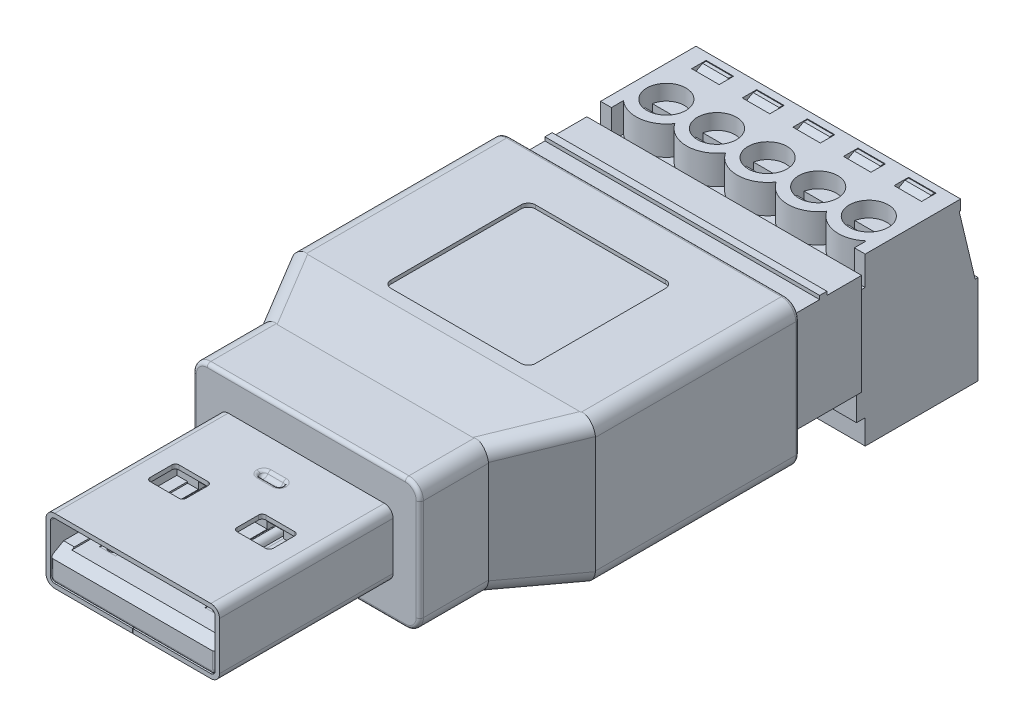
from build123d import *
from build123d.topology import SkipClean

# Parameters (mm, degrees)
BOSS_EXTRUDE1_START             = 5
BOSS_EXTRUDE1_DEPTH             = 10
CUT_EXTRUDE1_DEPTH              = 18.183494988
CUT_EXTRUDE1_DEPTH_BACK         = 18.183494988
BOSS_EXTRUDE2_DEPTH             = 9.5
BOSS_EXTRUDE3_DEPTH             = 9.15
SKETCH9_R                       = 1.35
SKETCH9_W                       = 1.9
SKETCH9_H                       = 1
CUT_EXTRUDE2_DEPTH              = 2
CUT_EXTRUDE3_DEPTH              = 2
BOSS_EXTRUDE4_REACH             = 29.744
SKETCH13_W                      = 0.05
SKETCH13_H                      = 1
CUT_EXTRUDE4_DEPTH              = 10
SKETCH15_W                      = 2.5
SKETCH15_H                      = 4
CUT_EXTRUDE5_DEPTH              = 2
DRAFT1_ANGLE                    = 5
DRAFT2_ANGLE                    = 30
SKETCH16_W                      = 8.575022673
SKETCH16_H                      = 3.670322135
CUT_EXTRUDE6_DEPTH              = 2
SKETCH17_W                      = 0.4
SKETCH17_H                      = 0.8
BOSS_EXTRUDE5_DEPTH             = 8.575022673
SKETCH18_W                      = 1.9
SKETCH18_H                      = 1
CUT_EXTRUDE7_DEPTH              = 1
BOSS_EXTRUDE6_REACH             = 29.744
CUT_EXTRUDE8_DEPTH              = 1
CUT_EXTRUDE8_DEPTH_BACK         = 0.5
SKETCH20_W                      = 0.05
SKETCH20_H                      = 1
SKETCH21_W                      = 0.7
SKETCH21_H                      = 0.6
CUT_EXTRUDE9_DEPTH              = 3
CUT_EXTRUDE10_DEPTH             = 0.25
FILLET1_R                       = 1
FILLET2_R                       = 0.25
EXTRUDE_THIN1_DEPTH             = 12
REVOLVE1_ANGLE                  = 180
FILLET3_R                       = 0.25
CUT_EXTRUDE12_DEPTH             = 29.410825525
CUT_EXTRUDE_THIN1_DEPTH         = 0.3
SKETCH31_R                      = 1.25
BOSS_EXTRUDE7_DEPTH             = 1
SKETCH32_W                      = 2.7
SKETCH32_H                      = 0.5
CUT_EXTRUDE13_DEPTH             = 0.5
LPATTERN1_COUNT                 = 5
LPATTERN1_PITCH                 = 3.5
BOSS_EXTRUDE8_REACH             = 29.744
BOSS_EXTRUDE8_DIRECTION_2_REACH = 29.744
FILLET4_R                       = 0.3
CHAMFER1_SIZE                   = 0.53
CHAMFER1_SIZE2                  = 0.917986928
SKETCH35_W                      = 1.125
SKETCH35_H                      = 6.85
SKETCH35_H_2                    = 5.85
CUT_EXTRUDE14_DEPTH             = 0.15
SKETCH36_W                      = 1.125
SKETCH36_H                      = 3.25
CUT_EXTRUDE15_DEPTH             = 0.525
BOSS_EXTRUDE9_DEPTH             = 0.35
BOSS_EXTRUDE9_2_DEPTH           = 0.35
BOSS_EXTRUDE9_3_DEPTH           = 0.35
BOSS_EXTRUDE9_4_DEPTH           = 0.35
SKETCH38_OUTSIDE_W              = 31.578
SKETCH38_OUTSIDE_H              = 25.028
SKETCH38_OUTSIDE_R              = 0.35
CUT_EXTRUDE16_DEPTH             = 40.412942063
CUT_EXTRUDE17_DEPTH             = 28.743693104
CUT_EXTRUDE17_DEPTH_BACK        = 28.743693104
CUT_EXTRUDE18_DEPTH             = 28.743693104
CUT_EXTRUDE18_DEPTH_BACK        = 28.743693104
SKETCH41_W                      = 9.9125
SKETCH41_H                      = 8.75
CUT_EXTRUDE19_DEPTH             = 0.1
FILLET5_R                       = 0.2
CUT_EXTRUDE20_DEPTH             = 0.25


with BuildPart() as part:
    # Sketch4 → Boss-Extrude1 (new body)
    with BuildSketch(Plane(origin=(0, 0, 0), x_dir=(1, 0, 0), z_dir=(0, 1, 0)).offset(BOSS_EXTRUDE1_START)):
        Polygon((-10.5, 10.95), (0, 10.95), (0, -12.65), (-7.85, -12.65), (-7.85, -7.9), (-10.5, -3.15), align=None)
    extrude(amount=-BOSS_EXTRUDE1_DEPTH)

    # Sketch5 → Cut-Extrude1 (cut, two sides: drawn at the far end of the back side and taken through both)
    with BuildSketch(Plane(origin=(0, 0, 0), x_dir=(0, 0, -1), z_dir=(1, 0, 0)).offset(-CUT_EXTRUDE1_DEPTH_BACK)):
        Polygon((41.177338913, -9.666035675), (-3.15, -5), (-7.9, -4.5), (-12.65, -4.5), (-12.65, 4.5), (-7.9, 4.5), (-3.15, 5), (41.177338913, 9.666035675), (-47.96714749, 9.666035675), (-47.96714749, -9.666035675), align=None)
    extrude(amount=CUT_EXTRUDE1_DEPTH + CUT_EXTRUDE1_DEPTH_BACK, mode=Mode.SUBTRACT)

    # Sketch23 → Cut-Extrude10 (cut)
    with BuildSketch(Plane(origin=(0, 5, 0), x_dir=(1, 0, 0), z_dir=(0, 1, 0))):
        with BuildLine():
            Line((-4.5, 7.7), (4.5, 7.7))
            ThreePointArc((4.5, 7.7), (4.853553391, 7.553553391), (5, 7.2))
            Line((5, 7.2), (5, -1.8))
            ThreePointArc((5, -1.8), (4.853553391, -2.153553391), (4.5, -2.3))
            Line((4.5, -2.3), (-4.5, -2.3))
            ThreePointArc((-4.5, -2.3), (-4.853553391, -2.153553391), (-5, -1.8))
            Line((-5, -1.8), (-5, 7.2))
            ThreePointArc((-5, 7.2), (-4.853553391, 7.553553391), (-4.5, 7.7))
        make_face()
    extrude(amount=-CUT_EXTRUDE10_DEPTH, mode=Mode.SUBTRACT)

    # Fillet1
    # the kernel refuses this fillet: 1 mm, written as the material it takes off along each edge
    with BuildSketch(Plane(origin=(-7.85, -4.5, 15.15), x_dir=(1, 0, 0), z_dir=(0, 0, -1))) as fillet1_piece_1_section:
        with BuildLine():
            CenterArc((FILLET1_R, -FILLET1_R), FILLET1_R, 90, 90)
            Line((0, -FILLET1_R), (0, 0))
            Line((0, 0), (FILLET1_R, 0))
        make_face()
    fillet1_piece_1 = extrude(amount=9.75, mode=Mode.PRIVATE)
    fillet1_piece_1 = split(fillet1_piece_1, bisect_by=Plane(origin=(-5.900487361, -4.351700384, 11.394409448), z_dir=(-0.8732886642419329, 0, 0.487203149524447)), keep=Keep.TOP, mode=Mode.PRIVATE)
    fillet1_piece_1 = split(fillet1_piece_1, bisect_by=Plane(origin=(-7.58529816, -4.036715763, 12.30120025), z_dir=(0, -0.9945054529214061, 0.10468478451804247)), keep=Keep.TOP, mode=Mode.PRIVATE)
    add(fillet1_piece_1, mode=Mode.SUBTRACT)
    with BuildSketch(Plane(origin=(-7.85, -4.5, 15.15), x_dir=(1, 0, 0), z_dir=(0, 0, -1))) as fillet1_piece_2_section:
        with BuildLine():
            CenterArc((FILLET1_R, -FILLET1_R), FILLET1_R, 90, 90)
            Line((0, -FILLET1_R), (0, 0))
            Line((0, 0), (FILLET1_R, 0))
        make_face()
    fillet1_piece_2 = extrude(amount=9.75, mode=Mode.PRIVATE)
    fillet1_piece_2 = split(fillet1_piece_2, bisect_by=Plane(origin=(-6.896060868, -4.042549312, 9.609890897), z_dir=(-0.8732886642419329, 0, 0.487203149524447)), keep=Keep.TOP, mode=Mode.PRIVATE)
    fillet1_piece_2 = split(fillet1_piece_2, bisect_by=Plane(origin=(-7.768276495, -4.266310608, 10.120049226), z_dir=(0, 0.9945054529214061, -0.10468478451804247)), keep=Keep.TOP, mode=Mode.PRIVATE)
    add(fillet1_piece_2, mode=Mode.SUBTRACT)
    with BuildSketch(Plane(origin=(-7.85, -4.5, 15.15), x_dir=(1, 0, 0), z_dir=(0, 0, -1))) as fillet1_piece_3_section:
        with BuildLine():
            CenterArc((FILLET1_R, -FILLET1_R), FILLET1_R, 90, 90)
            Line((0, -FILLET1_R), (0, 0))
            Line((0, 0), (FILLET1_R, 0))
        make_face()
    fillet1_piece_3 = extrude(amount=9.75, mode=Mode.PRIVATE)
    fillet1_piece_3 = split(fillet1_piece_3, bisect_by=Plane(origin=(-7.455417166, -4.491750675, 8.607271118), z_dir=(0.8732886642419329, 0, -0.487203149524447)), keep=Keep.TOP, mode=Mode.PRIVATE)
    fillet1_piece_3 = split(fillet1_piece_3, bisect_by=Plane(origin=(-7.239168841, -4.438836068, 8.481057357), z_dir=(0, -0.9945054529214061, 0.10468478451804247)), keep=Keep.TOP, mode=Mode.PRIVATE)
    add(fillet1_piece_3, mode=Mode.SUBTRACT)
    with BuildSketch(Plane(origin=(-7.85, 4.5, 5.4), x_dir=(1, 0, 0), z_dir=(0, 0, 1))) as fillet1_piece_4_section:
        with BuildLine():
            CenterArc((FILLET1_R, -FILLET1_R), FILLET1_R, 90, 90)
            Line((0, -FILLET1_R), (0, 0))
            Line((0, 0), (FILLET1_R, 0))
        make_face()
    fillet1_piece_4 = extrude(amount=9.75, mode=Mode.PRIVATE)
    fillet1_piece_4 = split(fillet1_piece_4, bisect_by=Plane(origin=(-6.896060868, 4.042549312, 9.609890897), z_dir=(-0.8732886642419329, 0, 0.487203149524447)), keep=Keep.TOP, mode=Mode.PRIVATE)
    fillet1_piece_4 = split(fillet1_piece_4, bisect_by=Plane(origin=(-7.768276495, 4.266310608, 10.120049226), z_dir=(0, -0.9945054529214061, -0.10468478451804242)), keep=Keep.TOP, mode=Mode.PRIVATE)
    add(fillet1_piece_4, mode=Mode.SUBTRACT)
    with BuildSketch(Plane(origin=(-7.85, 4.5, 5.4), x_dir=(1, 0, 0), z_dir=(0, 0, 1))) as fillet1_piece_5_section:
        with BuildLine():
            CenterArc((FILLET1_R, -FILLET1_R), FILLET1_R, 90, 90)
            Line((0, -FILLET1_R), (0, 0))
            Line((0, 0), (FILLET1_R, 0))
        make_face()
    fillet1_piece_5 = extrude(amount=9.75, mode=Mode.PRIVATE)
    fillet1_piece_5 = split(fillet1_piece_5, bisect_by=Plane(origin=(-7.455417166, 4.491750675, 8.607271118), z_dir=(0.8732886642419329, 0, -0.487203149524447)), keep=Keep.TOP, mode=Mode.PRIVATE)
    fillet1_piece_5 = split(fillet1_piece_5, bisect_by=Plane(origin=(-7.239168841, 4.438836068, 8.481057357), z_dir=(0, 0.9945054529214061, 0.10468478451804242)), keep=Keep.TOP, mode=Mode.PRIVATE)
    add(fillet1_piece_5, mode=Mode.SUBTRACT)
    with BuildSketch(Plane(origin=(-7.85, 4.5, 5.4), x_dir=(1, 0, 0), z_dir=(0, 0, 1))) as fillet1_piece_6_section:
        with BuildLine():
            CenterArc((FILLET1_R, -FILLET1_R), FILLET1_R, 90, 90)
            Line((0, -FILLET1_R), (0, 0))
            Line((0, 0), (FILLET1_R, 0))
        make_face()
    fillet1_piece_6 = extrude(amount=9.75, mode=Mode.PRIVATE)
    fillet1_piece_6 = split(fillet1_piece_6, bisect_by=Plane(origin=(-5.900487361, 4.351700384, 11.394409448), z_dir=(-0.8732886642419329, 0, 0.487203149524447)), keep=Keep.TOP, mode=Mode.PRIVATE)
    fillet1_piece_6 = split(fillet1_piece_6, bisect_by=Plane(origin=(-7.58529816, 4.036715763, 12.30120025), z_dir=(0, 0.9945054529214061, 0.10468478451804242)), keep=Keep.TOP, mode=Mode.PRIVATE)
    add(fillet1_piece_6, mode=Mode.SUBTRACT)
    with BuildSketch(Plane(origin=(-11.652533107, 5.217459077, 1.084138771), x_dir=(-0.04459817325900825, -0.9958014761265791, -0.07994012187935078), z_dir=(0.4851576154699628, -0.09153917273018133, 0.8696221409367253))) as fillet1_piece_7_section:
        with BuildLine():
            CenterArc((FILLET1_R * 0.950233960928, FILLET1_R), FILLET1_R, 182.923511118, 87.076488882)
            Line((-FILLET1_R * 0.0484645515405, FILLET1_R * 0.948997243276), (0, 0))
            Line((0, 0), (FILLET1_R * 0.950233960928, 0))
        make_face()
    fillet1_piece_7 = extrude(amount=10.213312241, mode=Mode.PRIVATE)
    fillet1_piece_7 = split(fillet1_piece_7, bisect_by=Plane(origin=(-7.85, 4.282028082, 5.783422109), z_dir=(-1, 0, 0)), keep=Keep.TOP, mode=Mode.PRIVATE)
    fillet1_piece_7 = split(fillet1_piece_7, bisect_by=Plane(origin=(-8.947322125, 4.5, 5.783422109), z_dir=(0, -1, 0)), keep=Keep.TOP, mode=Mode.PRIVATE)
    add(fillet1_piece_7, mode=Mode.SUBTRACT)
    with BuildSketch(Plane(origin=(-11.652533107, 5.217459077, 1.084138771), x_dir=(-0.04459817325900825, -0.9958014761265791, -0.07994012187935078), z_dir=(0.4851576154699628, -0.09153917273018133, 0.8696221409367253))) as fillet1_piece_8_section:
        with BuildLine():
            CenterArc((FILLET1_R * 0.950233960928, FILLET1_R), FILLET1_R, 182.923511118, 87.076488882)
            Line((-FILLET1_R * 0.0484645515405, FILLET1_R * 0.948997243276), (0, 0))
            Line((0, 0), (FILLET1_R * 0.950233960928, 0))
        make_face()
    fillet1_piece_8 = extrude(amount=10.213312241, mode=Mode.PRIVATE)
    fillet1_piece_8 = split(fillet1_piece_8, bisect_by=Plane(origin=(-7.85, 4.808921176, 3.642336473), z_dir=(-1, 0, 0)), keep=Keep.TOP, mode=Mode.PRIVATE)
    fillet1_piece_8 = split(fillet1_piece_8, bisect_by=Plane(origin=(-9.936894262, 4.5, 3.642336473), z_dir=(0, 1, 0)), keep=Keep.TOP, mode=Mode.PRIVATE)
    add(fillet1_piece_8, mode=Mode.SUBTRACT)
    with BuildSketch(Plane(origin=(-11.652533107, 5.217459077, 1.084138771), x_dir=(-0.04459817325900825, -0.9958014761265791, -0.07994012187935078), z_dir=(0.4851576154699628, -0.09153917273018133, 0.8696221409367253))) as fillet1_piece_9_section:
        with BuildLine():
            CenterArc((FILLET1_R * 0.950233960928, FILLET1_R), FILLET1_R, 182.923511118, 87.076488882)
            Line((-FILLET1_R * 0.0484645515405, FILLET1_R * 0.948997243276), (0, 0))
            Line((0, 0), (FILLET1_R * 0.950233960928, 0))
        make_face()
    fillet1_piece_9 = extrude(amount=10.213312241, mode=Mode.PRIVATE)
    fillet1_piece_9 = split(fillet1_piece_9, bisect_by=Plane(origin=(-7.85, 4.557677752, 7.268472572), z_dir=(1, 0, 0)), keep=Keep.TOP, mode=Mode.PRIVATE)
    fillet1_piece_9 = split(fillet1_piece_9, bisect_by=Plane(origin=(-7.544307912, 4.5, 7.268472572), z_dir=(0, 1, 0)), keep=Keep.TOP, mode=Mode.PRIVATE)
    add(fillet1_piece_9, mode=Mode.SUBTRACT)
    with BuildSketch(Plane(origin=(-6.697466893, -4.282540923, 9.965861229), x_dir=(-0.04459817325900605, 0.9958014761265791, -0.07994012187935205), z_dir=(-0.4851576154699628, -0.09153917273018138, -0.8696221409367253))) as fillet1_piece_10_section:
        with BuildLine():
            CenterArc((FILLET1_R * 0.950233960928, FILLET1_R), FILLET1_R, 182.923511118, 87.076488882)
            Line((-FILLET1_R * 0.0484645515405, FILLET1_R * 0.948997243276), (0, 0))
            Line((0, 0), (FILLET1_R * 0.950233960928, 0))
        make_face()
    fillet1_piece_10 = extrude(amount=10.213312241, mode=Mode.PRIVATE)
    fillet1_piece_10 = split(fillet1_piece_10, bisect_by=Plane(origin=(-7.85, -4.557677752, 7.268472572), z_dir=(1, 0, 0)), keep=Keep.TOP, mode=Mode.PRIVATE)
    fillet1_piece_10 = split(fillet1_piece_10, bisect_by=Plane(origin=(-7.544307912, -4.5, 7.268472572), z_dir=(0, -1, 0)), keep=Keep.TOP, mode=Mode.PRIVATE)
    add(fillet1_piece_10, mode=Mode.SUBTRACT)
    with BuildSketch(Plane(origin=(-6.697466893, -4.282540923, 9.965861229), x_dir=(-0.04459817325900605, 0.9958014761265791, -0.07994012187935205), z_dir=(-0.4851576154699628, -0.09153917273018138, -0.8696221409367253))) as fillet1_piece_11_section:
        with BuildLine():
            CenterArc((FILLET1_R * 0.950233960928, FILLET1_R), FILLET1_R, 182.923511118, 87.076488882)
            Line((-FILLET1_R * 0.0484645515405, FILLET1_R * 0.948997243276), (0, 0))
            Line((0, 0), (FILLET1_R * 0.950233960928, 0))
        make_face()
    fillet1_piece_11 = extrude(amount=10.213312241, mode=Mode.PRIVATE)
    fillet1_piece_11 = split(fillet1_piece_11, bisect_by=Plane(origin=(-7.85, -4.282028082, 5.783422109), z_dir=(-1, 0, 0)), keep=Keep.TOP, mode=Mode.PRIVATE)
    fillet1_piece_11 = split(fillet1_piece_11, bisect_by=Plane(origin=(-8.947322125, -4.5, 5.783422109), z_dir=(0, 1, 0)), keep=Keep.TOP, mode=Mode.PRIVATE)
    add(fillet1_piece_11, mode=Mode.SUBTRACT)
    with BuildSketch(Plane(origin=(-6.697466893, -4.282540923, 9.965861229), x_dir=(-0.04459817325900605, 0.9958014761265791, -0.07994012187935205), z_dir=(-0.4851576154699628, -0.09153917273018138, -0.8696221409367253))) as fillet1_piece_12_section:
        with BuildLine():
            CenterArc((FILLET1_R * 0.950233960928, FILLET1_R), FILLET1_R, 182.923511118, 87.076488882)
            Line((-FILLET1_R * 0.0484645515405, FILLET1_R * 0.948997243276), (0, 0))
            Line((0, 0), (FILLET1_R * 0.950233960928, 0))
        make_face()
    fillet1_piece_12 = extrude(amount=10.213312241, mode=Mode.PRIVATE)
    fillet1_piece_12 = split(fillet1_piece_12, bisect_by=Plane(origin=(-7.85, -4.808921176, 3.642336473), z_dir=(-1, 0, 0)), keep=Keep.TOP, mode=Mode.PRIVATE)
    fillet1_piece_12 = split(fillet1_piece_12, bisect_by=Plane(origin=(-9.936894262, -4.5, 3.642336473), z_dir=(0, -1, 0)), keep=Keep.TOP, mode=Mode.PRIVATE)
    add(fillet1_piece_12, mode=Mode.SUBTRACT)
    with BuildSketch(Plane(origin=(-10.5, -5, 5.65), x_dir=(0, 1, 0), z_dir=(0, 0, -1))) as fillet1_piece_13:
        with BuildLine():
            CenterArc((FILLET1_R, FILLET1_R), FILLET1_R, 180, 90)
            Line((0, FILLET1_R), (0, 0))
            Line((0, 0), (FILLET1_R, 0))
        make_face()
    extrude(amount=19.1, mode=Mode.SUBTRACT)
    with BuildSketch(Plane(origin=(-10.5, 5, 5.65), x_dir=(0, -1, 0), z_dir=(0, 0, -1))) as fillet1_piece_14:
        with BuildLine():
            CenterArc((FILLET1_R, -FILLET1_R), FILLET1_R, 90, 90)
            Line((0, -FILLET1_R), (0, 0))
            Line((0, 0), (FILLET1_R, 0))
        make_face()
    extrude(amount=19.1, mode=Mode.SUBTRACT)
    with BuildSketch(Plane(origin=(-6.697466893, -4.282540923, 9.965861229), x_dir=(-0.04459817325900605, 0.9958014761265791, -0.07994012187935205), z_dir=(-0.4851576154699628, -0.09153917273018138, -0.8696221409367253))) as fillet1_piece_15a_section:
        with BuildLine():
            CenterArc((FILLET1_R * 0.950233960928, FILLET1_R), FILLET1_R, 182.923511118, 87.076488882)
            Line((-FILLET1_R * 0.0484645515405, FILLET1_R * 0.948997243276), (0, 0))
            Line((0, 0), (FILLET1_R * 0.950233960928, 0))
        make_face()
    fillet1_piece_15a = extrude(amount=10.213312241, mode=Mode.PRIVATE)
    fillet1_piece_15a = split(fillet1_piece_15a, bisect_by=Plane(origin=(-7.85, -4.198194063, 8.73799321), z_dir=(1, 0, 0)), keep=Keep.TOP, mode=Mode.PRIVATE)
    fillet1_piece_15a = split(fillet1_piece_15a, bisect_by=Plane(origin=(-7.138897424, -4.5, 8.73799321), z_dir=(0, 1, 0)), keep=Keep.TOP, mode=Mode.PRIVATE)
    with BuildSketch(Plane(origin=(-7.85, -4.5, 15.15), x_dir=(1, 0, 0), z_dir=(0, 0, -1))) as fillet1_piece_15b_section:
        with BuildLine():
            CenterArc((FILLET1_R, -FILLET1_R), FILLET1_R, 90, 90)
            Line((0, -FILLET1_R), (0, 0))
            Line((0, 0), (FILLET1_R, 0))
        make_face()
    fillet1_piece_15b = extrude(amount=9.75, mode=Mode.PRIVATE)
    fillet1_piece_15b = split(fillet1_piece_15b, bisect_by=Plane(origin=(-8.271489961, -4.278118065, 7.144499127), z_dir=(0.8732886642419329, 0, -0.487203149524447)), keep=Keep.TOP, mode=Mode.PRIVATE)
    fillet1_piece_15b = split(fillet1_piece_15b, bisect_by=Plane(origin=(-7.616902316, -4.614243188, 6.814689717), z_dir=(0, 0.9945054529214061, -0.10468478451804247)), keep=Keep.TOP, mode=Mode.PRIVATE)
    fillet1_piece_15 = fillet1_piece_15a & fillet1_piece_15b
    add(fillet1_piece_15, mode=Mode.SUBTRACT)
    with BuildSketch(Plane(origin=(-11.652533107, 5.217459077, 1.084138771), x_dir=(-0.04459817325900825, -0.9958014761265791, -0.07994012187935078), z_dir=(0.4851576154699628, -0.09153917273018133, 0.8696221409367253))) as fillet1_piece_16a_section:
        with BuildLine():
            CenterArc((FILLET1_R * 0.950233960928, FILLET1_R), FILLET1_R, 182.923511118, 87.076488882)
            Line((-FILLET1_R * 0.0484645515405, FILLET1_R * 0.948997243276), (0, 0))
            Line((0, 0), (FILLET1_R * 0.950233960928, 0))
        make_face()
    fillet1_piece_16a = extrude(amount=10.213312241, mode=Mode.PRIVATE)
    fillet1_piece_16a = split(fillet1_piece_16a, bisect_by=Plane(origin=(-7.85, 4.198194063, 8.73799321), z_dir=(1, 0, 0)), keep=Keep.TOP, mode=Mode.PRIVATE)
    fillet1_piece_16a = split(fillet1_piece_16a, bisect_by=Plane(origin=(-7.138897424, 4.5, 8.73799321), z_dir=(0, -1, 0)), keep=Keep.TOP, mode=Mode.PRIVATE)
    with BuildSketch(Plane(origin=(-7.85, 4.5, 5.4), x_dir=(1, 0, 0), z_dir=(0, 0, 1))) as fillet1_piece_16b_section:
        with BuildLine():
            CenterArc((FILLET1_R, -FILLET1_R), FILLET1_R, 90, 90)
            Line((0, -FILLET1_R), (0, 0))
            Line((0, 0), (FILLET1_R, 0))
        make_face()
    fillet1_piece_16b = extrude(amount=9.75, mode=Mode.PRIVATE)
    fillet1_piece_16b = split(fillet1_piece_16b, bisect_by=Plane(origin=(-8.271489961, 4.278118065, 7.144499127), z_dir=(0.8732886642419329, 0, -0.487203149524447)), keep=Keep.TOP, mode=Mode.PRIVATE)
    fillet1_piece_16b = split(fillet1_piece_16b, bisect_by=Plane(origin=(-7.616902316, 4.614243188, 6.814689717), z_dir=(0, -0.9945054529214061, -0.10468478451804242)), keep=Keep.TOP, mode=Mode.PRIVATE)
    fillet1_piece_16 = fillet1_piece_16a & fillet1_piece_16b
    add(fillet1_piece_16, mode=Mode.SUBTRACT)

    # Fillet2
    fillet2_edges = [part.edges().sort_by_distance(p)[0] for p in [
        (-4.75, -5, -10.95),
        (-3.425, 4.5, 12.65),
        (-3.425, -4.5, 12.65),
        (-4.75, 5, -10.95),
        (-7.85, 0, 12.65),
        (-7.557106781, 4.207106781, 12.65),
        (-7.557106781, -4.207106781, 12.65),
        (-10.5, 0, -10.95),
        (-10.207106781, 4.707106781, -10.95),
        (-10.207106781, -4.707106781, -10.95),
    ]]
    fillet(fillet2_edges, radius=FILLET2_R)

    # Mirror1 3: part across plane


with BuildPart() as body_2:
    # Sketch7 → Boss-Extrude2 (new body)
    with BuildSketch(Plane(origin=(0, 0, 0), x_dir=(0, 0, -1), z_dir=(1, 0, 0))):
        Polygon((10.95, 3.5), (13.35, 3.5), (13.35, 3.75), (13.85, 3.75), (13.85, 3.5), (16.25, 3.5), (16.25, -3.5), (10.95, -3.5), align=None)
    extrude(amount=-BOSS_EXTRUDE2_DEPTH)

    # Mirror1 2: body 2 across plane


with BuildPart() as body_3:
    # Sketch8 → Boss-Extrude3 (new body)
    with BuildSketch(Plane(origin=(0, 0, 0), x_dir=(0, 0, -1), z_dir=(1, 0, 0))):
        Polygon((16.85, -5.5), (16.25, -5.5), (16.25, 2.3), (16.85, 2.3), (16.85, 4.3), (23.45, 4.3), (23.45, 3.6), (23.35, 3.6), (24.45, -1), (24.65, -1), (24.65, -7.2), (16.85, -7.2), align=None)
    extrude(amount=-BOSS_EXTRUDE3_DEPTH)

    # Sketch9 → Cut-Extrude2 (cut)
    with BuildSketch(Plane(origin=(0, 4.3, 0), x_dir=(1, 0, 0), z_dir=(0, 1, 0))):
        with Locations((0, 19.25)):
            Circle(SKETCH9_R)
        with Locations(Location((-3.5, 19.25, 0), (0, 0, 270))):
            Circle(SKETCH9_R)
        with Locations(Location((-7, 19.25, 0), (0, 0, 270))):
            Circle(SKETCH9_R)
        with Locations((-7, 22.45)):
            Rectangle(SKETCH9_W, SKETCH9_H)
        with Locations((-3.5, 22.45)):
            Rectangle(SKETCH9_W, SKETCH9_H)
        with Locations((0, 22.45)):
            Rectangle(SKETCH9_W, SKETCH9_H)
    extrude(amount=-CUT_EXTRUDE2_DEPTH, mode=Mode.SUBTRACT)

    # Sketch10 → Cut-Extrude3 (cut)
    with BuildSketch(Plane(origin=(0, 4.3, 0), x_dir=(1, 0, 0), z_dir=(0, 1, 0))):
        with BuildLine():
            Line((-8.4, 17.684752416), (-8.4, 16.85))
            Line((-8.4, 16.85), (0, 16.85))
            Line((0, 16.85), (0, 17.15))
            ThreePointArc((0, 17.15), (-0.993046016, 17.399632574), (-1.75, 18.089181323))
            ThreePointArc((-1.75, 18.089181323), (-3.5, 17.15), (-5.25, 18.089181323))
            ThreePointArc((-5.25, 18.089181323), (-6.732575833, 17.167097142), (-8.4, 17.684752416))
        make_face()
    extrude(amount=-CUT_EXTRUDE3_DEPTH, mode=Mode.SUBTRACT)

    # Boss-Extrude4: up to this face of the body (flat: up to its plane)
    boss_extrude4_end = Plane(body_3.part.faces().sort_by_distance((-7.95, 3.3, -22.45))[0])
    # Sketch12 → Boss-Extrude4 (add, up to the picked face)
    with BuildSketch(Plane(origin=(0, 0, 0), x_dir=(0, 0, -1), z_dir=(1, 0, 0)), mode=Mode.PRIVATE) as boss_extrude4_sk1:
        Polygon((22.9, 4.3), (22.9, 3.3), (22.95, 3.3), (22.95, 2.3), (21.95, 2.3), (21.95, 3.6), (22.2, 3.6), (22.2, 4.040192379), (22.65, 4.3), align=None)
    boss_extrude4_tool1 = split(extrude(boss_extrude4_sk1.sketch, amount=-BOSS_EXTRUDE4_REACH, mode=Mode.PRIVATE), bisect_by=boss_extrude4_end, keep=Keep.BOTH, mode=Mode.PRIVATE)
    add(boss_extrude4_tool1.solids().sort_by(Axis((0, 3.188063, -22.4778), (-1, 0, 0)))[0])

    # Sketch13 → Cut-Extrude4 (cut)
    with BuildSketch(Plane(origin=(0, 3.6, 0), x_dir=(1, 0, 0), z_dir=(0, 1, 0))):
        with Locations((-7.925, 22.45)):
            Rectangle(SKETCH13_W, SKETCH13_H)
        with Locations((-6.075, 22.45)):
            Rectangle(SKETCH13_W, SKETCH13_H)
        with Locations((-4.425, 22.45)):
            Rectangle(SKETCH13_W, SKETCH13_H)
        with Locations((-2.575, 22.45)):
            Rectangle(SKETCH13_W, SKETCH13_H)
        with Locations((-0.925, 22.45)):
            Rectangle(SKETCH13_W, SKETCH13_H)
    extrude(amount=CUT_EXTRUDE4_DEPTH, mode=Mode.SUBTRACT)

    # Sketch15 → Cut-Extrude5 (cut)
    with BuildSketch(Plane(origin=(0, 0, -24.65), x_dir=(-1, 0, 0), z_dir=(0, 0, -1))):
        with Locations((7, -3.85)):
            Rectangle(SKETCH15_W, SKETCH15_H)
        with Locations((3.5, -3.85)):
            Rectangle(SKETCH15_W, SKETCH15_H)
        with Locations((0, -3.85)):
            Rectangle(SKETCH15_W, SKETCH15_H)
    extrude(amount=-CUT_EXTRUDE5_DEPTH, mode=Mode.SUBTRACT)

    # Draft1
    draft1_faces = [body_3.faces().sort_by_distance(p)[0] for p in [
        (-0.625, -5.85, -23.65),
        (-3.5, -5.85, -23.65),
        (-2.25, -3.85, -23.65),
        (-1.25, -3.85, -23.65),
        (-4.75, -3.85, -23.65),
        (-7, -5.85, -23.65),
        (-8.25, -3.85, -23.65),
        (-5.75, -3.85, -23.65),
    ]]
    draft(draft1_faces, Plane(origin=(-9.15, -1, -24.65), x_dir=(0, -1, 0), z_dir=(0, 0, -1)), DRAFT1_ANGLE)

    # Draft2
    draft2_faces = [body_3.faces().sort_by_distance(p)[0] for p in [
        (-0.582353043, -1.85, -23.67508611),
        (-3.5, -1.85, -23.67508611),
        (-7, -1.85, -23.67508611),
    ]]
    draft(draft2_faces, Plane(origin=(-9.15, -1, -24.65), x_dir=(0, -1, 0), z_dir=(0, 0, -1)), DRAFT2_ANGLE)

    # Sketch16 → Cut-Extrude6 (cut)
    with BuildSketch(Plane(origin=(0, 0, -22.65), x_dir=(-1, 0, 0), z_dir=(0, 0, -1))):
        with Locations((4.287511337, -4.339861606)):
            Rectangle(SKETCH16_W, SKETCH16_H)
    extrude(amount=-CUT_EXTRUDE6_DEPTH, mode=Mode.SUBTRACT)

    # Sketch18 → Cut-Extrude7 (cut)
    with BuildSketch(Plane.XZ.offset(7.2)):
        with Locations((-7, -23.55)):
            Rectangle(SKETCH18_W, SKETCH18_H)
        with Locations((-3.5, -23.55)):
            Rectangle(SKETCH18_W, SKETCH18_H)
        with Locations((0, -23.55)):
            Rectangle(SKETCH18_W, SKETCH18_H)
    extrude(amount=-CUT_EXTRUDE7_DEPTH, mode=Mode.SUBTRACT)

    # Boss-Extrude6: up to this face of the body (flat: up to its plane)
    boss_extrude6_end = Plane(body_3.part.faces().sort_by_distance((-7.95, -6.7, -23.55))[0])
    # Sketch19 → Boss-Extrude6 (add, up to the picked face)
    with BuildSketch(Plane(origin=(0, 0, 0), x_dir=(0, 0, -1), z_dir=(1, 0, 0)), mode=Mode.PRIVATE) as boss_extrude6_sk1:
        Polygon((23.05, -6.7), (23.333493649, -6.7), (23.766506351, -6.95), (24.05, -6.95), (24.05, -6.2), (23.05, -6.2), align=None)
    boss_extrude6_tool1 = split(extrude(boss_extrude6_sk1.sketch, amount=-BOSS_EXTRUDE6_REACH, mode=Mode.PRIVATE), bisect_by=boss_extrude6_end, keep=Keep.BOTH, mode=Mode.PRIVATE)
    add(boss_extrude6_tool1.solids().sort_by(Axis((0, -6.521392, -23.596875), (-1, 0, 0)))[0])

    # Sketch20 → Cut-Extrude8 (cut, two sides: drawn at the far end of the back side and taken through both)
    with BuildSketch(Plane.XZ.offset(6.7).offset(-CUT_EXTRUDE8_DEPTH_BACK)):
        with Locations((-7.925, -23.55)):
            Rectangle(SKETCH20_W, SKETCH20_H)
        with Locations((-6.075, -23.55)):
            Rectangle(SKETCH20_W, SKETCH20_H)
        with Locations((-4.425, -23.55)):
            Rectangle(SKETCH20_W, SKETCH20_H)
        with Locations((-2.575, -23.55)):
            Rectangle(SKETCH20_W, SKETCH20_H)
        with Locations((-0.925, -23.55)):
            Rectangle(SKETCH20_W, SKETCH20_H)
    extrude(amount=CUT_EXTRUDE8_DEPTH + CUT_EXTRUDE8_DEPTH_BACK, mode=Mode.SUBTRACT)

    # Sketch21 → Cut-Extrude9 (cut)
    with BuildSketch(Plane.XZ.offset(5.5)):
        with Locations((-1.75, -16.55)):
            Rectangle(SKETCH21_W, SKETCH21_H)
        with Locations((-5.25, -16.55)):
            Rectangle(SKETCH21_W, SKETCH21_H)
    extrude(amount=-CUT_EXTRUDE9_DEPTH, mode=Mode.SUBTRACT)

    # Mirror1: body 3 across plane


with BuildPart() as body_4:
    # Sketch17 → Boss-Extrude5 (new body)
    with BuildSketch(Plane(origin=(-8.575022673, 0, 0), x_dir=(0, 0, -1), z_dir=(1, 0, 0))):
        with Locations((22.45, -2.904700538)):
            Rectangle(SKETCH17_W, SKETCH17_H)
    extrude(amount=BOSS_EXTRUDE5_DEPTH)

    # Mirror1 4: body 4 across plane


with BuildPart() as body_5:
    # Sketch24 → Extrude-Thin1 (new body)
    with BuildSketch(Plane.XY.offset(12.65)):
        with BuildLine():
            Line((6, -1.65), (6, 1.65))
            ThreePointArc((6, 1.65), (5.824264069, 2.074264069), (5.4, 2.25))
            Line((5.4, 2.25), (-5.4, 2.25))
            ThreePointArc((-5.4, 2.25), (-5.824264069, 2.074264069), (-6, 1.65))
            Line((-6, 1.65), (-6, -1.65))
            ThreePointArc((-6, -1.65), (-5.824264069, -2.074264069), (-5.4, -2.25))
            Line((-5.4, -2.25), (5.4, -2.25))
            ThreePointArc((5.4, -2.25), (5.824264069, -2.074264069), (6, -1.65))
        make_face()
        with BuildLine():
            Line((5.7, -1.65), (5.7, 1.65))
            ThreePointArc((5.7, 1.65), (5.612132034, 1.862132034), (5.4, 1.95))
            Line((5.4, 1.95), (-5.4, 1.95))
            ThreePointArc((-5.4, 1.95), (-5.612132034, 1.862132034), (-5.7, 1.65))
            Line((-5.7, 1.65), (-5.7, -1.65))
            ThreePointArc((-5.7, -1.65), (-5.612132034, -1.862132034), (-5.4, -1.95))
            Line((-5.4, -1.95), (5.4, -1.95))
            ThreePointArc((5.4, -1.95), (5.612132034, -1.862132034), (5.7, -1.65))
        make_face(mode=Mode.SUBTRACT)
    extrude(amount=EXTRUDE_THIN1_DEPTH)

    # Sketch25 → Revolve1 (revolve)
    with BuildSketch(Plane(origin=(0, 2.25, 0), x_dir=(-1, 0, 0), z_dir=(0, -1, 0))):
        with BuildLine():
            Line((-1.125, -15.05), (1.125, -15.05))
            Line((1.125, -15.05), (1.125, -15.056))
            ThreePointArc((1.125, -15.056), (0.951021428, -15.476021428), (0.531, -15.65))
            Line((0.531, -15.65), (-0.531, -15.65))
            ThreePointArc((-0.531, -15.65), (-0.951021428, -15.476021428), (-1.125, -15.056))
            Line((-1.125, -15.056), (-1.125, -15.05))
        make_face()
    revolve(axis=Axis((1.125, 2.25, 15.05), (1, 0, 0)), revolution_arc=REVOLVE1_ANGLE)

    # Sketch27 → Cut-Revolve1 (revolve, cut)
    with BuildSketch(Plane(origin=(0, 2.25, 0), x_dir=(1, 0, 0), z_dir=(0, 1, 0))):
        with BuildLine():
            Line((0.824938769, -15.05), (-0.824938769, -15.05))
            ThreePointArc((-0.824938769, -15.05), (-0.741, -15.261757138), (-0.531, -15.35))
            Line((-0.531, -15.35), (0.531, -15.35))
            ThreePointArc((0.531, -15.35), (0.741, -15.261757138), (0.824938769, -15.05))
        make_face()
    revolve(axis=Axis((0.824938769, 2.25, 15.05), (-1, 0, 0)), mode=Mode.SUBTRACT)

    # Fillet3
    fillet3_edges = [body_5.edges().sort_by_distance(p)[0] for p in [
        (0, 2.25, 15.35),
        (-0.741, 2.25, 15.261757138),
        (-0.741, 2.25, 14.838242862),
        (0.741, 2.25, 15.261757138),
        (0.741, 2.25, 14.838242862),
        (0, 2.25, 14.75),
    ]]
    fillet(fillet3_edges, radius=FILLET3_R)

    # Sketch28 → Cut-Extrude12 (cut, through all)
    with BuildSketch(Plane(origin=(0, 2.25, 0), x_dir=(1, 0, 0), z_dir=(0, 1, 0))):
        with BuildLine():
            Line((-4, -17.45), (-2, -17.45))
            ThreePointArc((-2, -17.45), (-1.823223305, -17.523223305), (-1.75, -17.7))
            Line((-1.75, -17.7), (-1.75, -19.2))
            ThreePointArc((-1.75, -19.2), (-1.823223305, -19.376776695), (-2, -19.45))
            Line((-2, -19.45), (-4, -19.45))
            ThreePointArc((-4, -19.45), (-4.176776695, -19.376776695), (-4.25, -19.2))
            Line((-4.25, -19.2), (-4.25, -17.7))
            ThreePointArc((-4.25, -17.7), (-4.176776695, -17.523223305), (-4, -17.45))
        make_face()
        with BuildLine():
            Line((1.75, -17.7), (1.75, -19.2))
            ThreePointArc((1.75, -19.2), (1.823223305, -19.376776695), (2, -19.45))
            Line((2, -19.45), (4, -19.45))
            ThreePointArc((4, -19.45), (4.176776695, -19.376776695), (4.25, -19.2))
            Line((4.25, -19.2), (4.25, -17.7))
            ThreePointArc((4.25, -17.7), (4.176776695, -17.523223305), (4, -17.45))
            Line((4, -17.45), (2, -17.45))
            ThreePointArc((2, -17.45), (1.823223305, -17.523223305), (1.75, -17.7))
        make_face()
    extrude(amount=-CUT_EXTRUDE12_DEPTH, mode=Mode.SUBTRACT)

    # Sketch30 → Cut-Extrude-Thin1 (cut)
    with BuildSketch(Plane.XZ.offset(2.25)):
        with BuildLine():
            Line((-0.01, 24.65), (-0.01, 22.7364))
            ThreePointArc((-0.01, 22.7364), (-0.112341655, 22.539803509), (-0.332084834, 22.510873771))
            Line((-0.332084834, 22.510873771), (-0.879273382, 22.710034115))
            ThreePointArc((-0.879273382, 22.710034115), (-1.117328493, 22.678693565), (-1.22819862, 22.465714034))
            Line((-1.22819862, 22.465714034), (-1.22819862, 20.465714034))
            ThreePointArc((-1.22819862, 20.465714034), (-1.117328493, 20.252734502), (-0.879273382, 20.221393952))
            Line((-0.879273382, 20.221393952), (-0.332084834, 20.420554296))
            ThreePointArc((-0.332084834, 20.420554296), (-0.112341655, 20.391624558), (-0.01, 20.195028067))
            Line((-0.01, 20.195028067), (-0.01, 14.305069862))
            ThreePointArc((-0.01, 14.305069862), (-0.112341655, 14.108473372), (-0.332084834, 14.079543633))
            Line((-0.332084834, 14.079543633), (-0.879273382, 14.278703977))
            ThreePointArc((-0.879273382, 14.278703977), (-1.117328493, 14.247363427), (-1.22819862, 14.034383896))
            Line((-1.22819862, 14.034383896), (-1.22819862, 12.034383896))
            ThreePointArc((-1.22819862, 12.034383896), (-1.117328493, 11.821404364), (-0.879273382, 11.790063814))
            Line((-0.879273382, 11.790063814), (-0.332084834, 11.989224158))
            ThreePointArc((-0.332084834, 11.989224158), (-0.112341655, 11.96029442), (-0.01, 11.763697929))
            Line((-0.01, 11.763697929), (-0.01, 9.850097929))
            Line((-0.01, 9.850097929), (0.01, 9.850097929))
            Line((0.01, 9.850097929), (0.01, 11.763697929))
            ThreePointArc((0.01, 11.763697929), (-0.100870127, 11.976677461), (-0.338925237, 12.008018011))
            Line((-0.338925237, 12.008018011), (-0.886113785, 11.808857667))
            ThreePointArc((-0.886113785, 11.808857667), (-1.105856964, 11.837787405), (-1.20819862, 12.034383896))
            Line((-1.20819862, 12.034383896), (-1.20819862, 14.034383896))
            ThreePointArc((-1.20819862, 14.034383896), (-1.105856964, 14.230980386), (-0.886113785, 14.259910125))
            Line((-0.886113785, 14.259910125), (-0.338925237, 14.060749781))
            ThreePointArc((-0.338925237, 14.060749781), (-0.100870127, 14.092090331), (0.01, 14.305069862))
            Line((0.01, 14.305069862), (0.01, 20.195028067))
            ThreePointArc((0.01, 20.195028067), (-0.100870127, 20.408007599), (-0.338925237, 20.439348149))
            Line((-0.338925237, 20.439348149), (-0.886113785, 20.240187805))
            ThreePointArc((-0.886113785, 20.240187805), (-1.105856964, 20.269117543), (-1.20819862, 20.465714034))
            Line((-1.20819862, 20.465714034), (-1.20819862, 22.465714034))
            ThreePointArc((-1.20819862, 22.465714034), (-1.105856964, 22.662310524), (-0.886113785, 22.691240263))
            Line((-0.886113785, 22.691240263), (-0.338925237, 22.492079919))
            ThreePointArc((-0.338925237, 22.492079919), (-0.100870127, 22.523420468), (0.01, 22.7364))
            Line((0.01, 22.7364), (0.01, 24.65))
            Line((0.01, 24.65), (-0.01, 24.65))
        make_face()
    extrude(amount=-CUT_EXTRUDE_THIN1_DEPTH, mode=Mode.SUBTRACT)


with BuildPart() as body_6:
    # Sketch31 → Boss-Extrude7 (new body)
    with BuildSketch(Plane(origin=(0, 2.3, 0), x_dir=(1, 0, 0), z_dir=(0, 1, 0))):
        with Locations(Location((-7, 19.25, 0), (0, 0, 270))):
            Circle(SKETCH31_R)
    extrude(amount=BOSS_EXTRUDE7_DEPTH)

    # Sketch32 → Cut-Extrude13 (cut)
    with BuildSketch(Plane(origin=(0, 3.3, 0), x_dir=(1, 0, 0), z_dir=(0, 1, 0))):
        with Locations((-7, 19.25)):
            Rectangle(SKETCH32_W, SKETCH32_H)
    extrude(amount=-CUT_EXTRUDE13_DEPTH, mode=Mode.SUBTRACT)


with BuildPart() as lpattern1_1:
    # LPattern1: pattern copy
    add(body_6.part.moved(Location(Vector(1, 0, 0) * (1 * LPATTERN1_PITCH))))


with BuildPart() as lpattern1_2:
    # LPattern1: pattern copy
    add(body_6.part.moved(Location(Vector(1, 0, 0) * (2 * LPATTERN1_PITCH))))


with BuildPart() as lpattern1_3:
    # LPattern1: pattern copy
    add(body_6.part.moved(Location(Vector(1, 0, 0) * (3 * LPATTERN1_PITCH))))


with BuildPart() as lpattern1_4:
    # LPattern1: pattern copy
    add(body_6.part.moved(Location(Vector(1, 0, 0) * (4 * LPATTERN1_PITCH))))


with BuildPart() as body_11:

    # Boss-Extrude8: up to this face of the body (flat: up to its plane)
    boss_extrude8_end = Plane(body_5.part.faces().sort_by_distance((-5.7, 0, 18.65))[0])
    # Sketch34 → Boss-Extrude8 (new, up to the picked face)
    with BuildSketch(Plane(origin=(0, 0, 0), x_dir=(0, 0, -1), z_dir=(1, 0, 0)), mode=Mode.PRIVATE) as boss_extrude8_sk1:
        Polygon((-24.65, 0), (-24.65, -1.95), (-12.65, -1.95), (-12.65, 1.95), (-15.9, 1.95), (-15.9, 0), align=None)
    boss_extrude8_tool1 = split(extrude(boss_extrude8_sk1.sketch, amount=-BOSS_EXTRUDE8_REACH, mode=Mode.PRIVATE), bisect_by=boss_extrude8_end, keep=Keep.BOTH, mode=Mode.PRIVATE)
    add(boss_extrude8_tool1.solids().sort_by(Axis((0, -0.559426, 17.717623), (-1, 0, 0)))[0])


    # Boss-Extrude8 direction 2: up to this face of the body (flat: up to its plane)
    boss_extrude8_direction_2_end = Plane(body_5.part.faces().sort_by_distance((5.7, 0, 18.65))[0])
    # Sketch34 → Boss-Extrude8 direction 2 (add, up to the picked face)
    with BuildSketch(Plane(origin=(0, 0, 0), x_dir=(0, 0, -1), z_dir=(1, 0, 0)), mode=Mode.PRIVATE) as boss_extrude8_direction_2_sk1:
        Polygon((-24.65, 0), (-24.65, -1.95), (-12.65, -1.95), (-12.65, 1.95), (-15.9, 1.95), (-15.9, 0), align=None)
    boss_extrude8_direction_2_tool1 = split(extrude(boss_extrude8_direction_2_sk1.sketch, amount=BOSS_EXTRUDE8_DIRECTION_2_REACH, mode=Mode.PRIVATE), bisect_by=boss_extrude8_direction_2_end, keep=Keep.BOTH, mode=Mode.PRIVATE)
    add(boss_extrude8_direction_2_tool1.solids().sort_by(Axis((0, -0.559426, 17.717623), (1, 0, 0)))[0])

    # Fillet4
    fillet4_edges = [body_11.edges().sort_by_distance(p)[0] for p in [
        (-5.7, -1.95, 18.65),
        (5.7, -1.95, 18.65),
    ]]
    fillet(fillet4_edges, radius=FILLET4_R)

    # Chamfer1
    chamfer1_edges = [body_11.edges().sort_by_distance(p)[0] for p in [
        (0, 0, 24.65),
    ]]
    chamfer1_side = [body_11.faces().sort_by_distance(p)[0] for p in [
        (0, -0.97341947, 24.65),
    ]]
    chamfer(chamfer1_edges, length=CHAMFER1_SIZE, length2=CHAMFER1_SIZE2, reference=chamfer1_side[0])

    # Sketch35 → Cut-Extrude14 (cut)
    with BuildSketch(Plane(origin=(0, 0, 0), x_dir=(1, 0, 0), z_dir=(0, 1, 0))):
        with Locations((-3.65, -19.325)):
            Rectangle(SKETCH35_W, SKETCH35_H)
        with Locations((3.65, -19.325)):
            Rectangle(SKETCH35_W, SKETCH35_H)
        with Locations((-1.11, -18.825)):
            Rectangle(SKETCH35_W, SKETCH35_H_2)
        with Locations((1.11, -18.825)):
            Rectangle(SKETCH35_W, SKETCH35_H_2)
    extrude(amount=-CUT_EXTRUDE14_DEPTH, mode=Mode.SUBTRACT)

    # Sketch36 → Cut-Extrude15 (cut)
    with BuildSketch(Plane(origin=(0, -0.15, 0), x_dir=(1, 0, 0), z_dir=(0, 1, 0))):
        with Locations((-3.65, -14.275)):
            Rectangle(SKETCH36_W, SKETCH36_H)
        with Locations((-1.11, -14.275)):
            Rectangle(SKETCH36_W, SKETCH36_H)
        with Locations((1.11, -14.275)):
            Rectangle(SKETCH36_W, SKETCH36_H)
        with Locations((3.65, -14.275)):
            Rectangle(SKETCH36_W, SKETCH36_H)
    extrude(amount=CUT_EXTRUDE15_DEPTH, mode=Mode.SUBTRACT)

    # Sketch41 → Cut-Extrude19 (cut)
    with BuildSketch(Plane(origin=(0, 0, 0), x_dir=(1, 0, 0), z_dir=(0, 1, 0))):
        with Locations((0, -20.275)):
            Rectangle(SKETCH41_W, SKETCH41_H)
    extrude(amount=-CUT_EXTRUDE19_DEPTH, mode=Mode.SUBTRACT)

    # Fillet5
    fillet5_edges = [body_11.edges().sort_by_distance(p)[0] for p in [
        (-5.7, -1.09, 24.65),
        (0, -1.95, 24.65),
        (5.7, -1.09, 24.65),
        (5.612132034, -1.862132034, 24.65),
        (-5.612132034, -1.862132034, 24.65),
    ]]
    fillet(fillet5_edges, radius=FILLET5_R)


with BuildPart() as body_12:
    # Sketch37 → Boss-Extrude9 (new body)
    with BuildSketch(Plane(origin=(0, -0.15, 0), x_dir=(1, 0, 0), z_dir=(0, 1, 0))):
        with BuildLine():
            Line((-0.75998, -21.3), (-0.75998, -13))
            ThreePointArc((-0.75998, -13), (-1.10998, -12.65), (-1.45998, -13))
            Line((-1.45998, -13), (-1.45998, -21.3))
            ThreePointArc((-1.45998, -21.3), (-1.10998, -21.65), (-0.75998, -21.3))
        make_face()
    extrude(amount=BOSS_EXTRUDE9_DEPTH)


with BuildPart() as body_13:
    # Sketch37 → Boss-Extrude9 2 (new body)
    with BuildSketch(Plane(origin=(0, -0.15, 0), x_dir=(1, 0, 0), z_dir=(0, 1, 0))):
        with BuildLine():
            Line((-3.99998, -22.3), (-3.99998, -13))
            ThreePointArc((-3.99998, -13), (-3.64998, -12.65), (-3.29998, -13))
            Line((-3.29998, -13), (-3.29998, -22.3))
            ThreePointArc((-3.29998, -22.3), (-3.64998, -22.65), (-3.99998, -22.3))
        make_face()
    extrude(amount=BOSS_EXTRUDE9_2_DEPTH)


with BuildPart() as body_14:
    # Sketch37 → Boss-Extrude9 3 (new body)
    with BuildSketch(Plane(origin=(0, -0.15, 0), x_dir=(1, 0, 0), z_dir=(0, 1, 0))):
        with BuildLine():
            Line((3.29998, -22.3), (3.29998, -13))
            ThreePointArc((3.29998, -13), (3.64998, -12.65), (3.99998, -13))
            Line((3.99998, -13), (3.99998, -22.3))
            ThreePointArc((3.99998, -22.3), (3.64998, -22.65), (3.29998, -22.3))
        make_face()
    extrude(amount=BOSS_EXTRUDE9_3_DEPTH)


with BuildPart() as body_15:
    # Sketch37 → Boss-Extrude9 4 (new body)
    with BuildSketch(Plane(origin=(0, -0.15, 0), x_dir=(1, 0, 0), z_dir=(0, 1, 0))):
        with BuildLine():
            Line((1.45998, -21.3), (1.45998, -13))
            ThreePointArc((1.45998, -13), (1.10998, -12.65), (0.75998, -13))
            Line((0.75998, -13), (0.75998, -21.3))
            ThreePointArc((0.75998, -21.3), (1.10998, -21.65), (1.45998, -21.3))
        make_face()
    extrude(amount=BOSS_EXTRUDE9_4_DEPTH)


with BuildPart() as cut_extrude16_tool:
    # Sketch38 outside → Cut-Extrude16 (new, through all)
    with BuildSketch(Plane(origin=(0, 0, 12.65), x_dir=(-1, 0, 0), z_dir=(0, 0, -1))):
        with Locations((1.125, -1.1)):
            Rectangle(SKETCH38_OUTSIDE_W, SKETCH38_OUTSIDE_H)
        with Locations((3.64998, -0.15)):
            Circle(SKETCH38_OUTSIDE_R, mode=Mode.SUBTRACT)
        with Locations((1.10998, -0.15)):
            Circle(SKETCH38_OUTSIDE_R, mode=Mode.SUBTRACT)
        with Locations((-1.10998, -0.15)):
            Circle(SKETCH38_OUTSIDE_R, mode=Mode.SUBTRACT)
        with Locations((-3.64998, -0.15)):
            Circle(SKETCH38_OUTSIDE_R, mode=Mode.SUBTRACT)
    extrude(amount=-CUT_EXTRUDE16_DEPTH)


with BuildPart() as body_13_1:
    add(body_13.part)

    # Cut-Extrude16: cut by cut_extrude16_tool
    add(cut_extrude16_tool.part, mode=Mode.SUBTRACT)


with BuildPart() as body_12_1:
    add(body_12.part)

    # Cut-Extrude16: cut by cut_extrude16_tool
    add(cut_extrude16_tool.part, mode=Mode.SUBTRACT)


with BuildPart() as body_15_1:
    add(body_15.part)

    # Cut-Extrude16: cut by cut_extrude16_tool
    add(cut_extrude16_tool.part, mode=Mode.SUBTRACT)


with BuildPart() as body_14_1:
    add(body_14.part)

    # Cut-Extrude16: cut by cut_extrude16_tool
    add(cut_extrude16_tool.part, mode=Mode.SUBTRACT)


with BuildPart() as cut_extrude17_tool:
    # Sketch39 → Cut-Extrude17 (new, two sides: drawn at the far end of the back side and taken through both)
    with BuildSketch(Plane(origin=(0, 0, 0), x_dir=(0, 0, -1), z_dir=(1, 0, 0)).offset(-CUT_EXTRUDE17_DEPTH_BACK)):
        with BuildLine():
            Line((-22.3, 0.2), (-22.65, 0.2))
            Line((-22.65, 0.2), (-22.65, -0.15))
            ThreePointArc((-22.65, -0.15), (-22.547487373, 0.097487373), (-22.3, 0.2))
        make_face()
    extrude(amount=CUT_EXTRUDE17_DEPTH + CUT_EXTRUDE17_DEPTH_BACK)


with BuildPart() as body_13_2:
    add(body_13_1.part)

    # Cut-Extrude17: cut by cut_extrude17_tool
    add(cut_extrude17_tool.part, mode=Mode.SUBTRACT)


with BuildPart() as body_14_2:
    add(body_14_1.part)

    # Cut-Extrude17: cut by cut_extrude17_tool
    add(cut_extrude17_tool.part, mode=Mode.SUBTRACT)


with BuildPart() as cut_extrude18_tool:
    # Sketch40 → Cut-Extrude18 (new, two sides: drawn at the far end of the back side and taken through both)
    with BuildSketch(Plane(origin=(0, 0, 0), x_dir=(0, 0, -1), z_dir=(1, 0, 0)).offset(-CUT_EXTRUDE18_DEPTH_BACK)):
        with BuildLine():
            Line((-21.3, 0.2), (-21.65, 0.2))
            Line((-21.65, 0.2), (-21.65, -0.15))
            ThreePointArc((-21.65, -0.15), (-21.547487373, 0.097487373), (-21.3, 0.2))
        make_face()
    extrude(amount=CUT_EXTRUDE18_DEPTH + CUT_EXTRUDE18_DEPTH_BACK)


with BuildPart() as body_12_2:
    add(body_12_1.part)

    # Cut-Extrude18: cut by cut_extrude18_tool
    add(cut_extrude18_tool.part, mode=Mode.SUBTRACT)


with BuildPart() as body_15_2:
    add(body_15_1.part)

    # Cut-Extrude18: cut by cut_extrude18_tool
    add(cut_extrude18_tool.part, mode=Mode.SUBTRACT)


with BuildPart() as body_3_1:
    with SkipClean():  # the faces are left unmerged after this step: merging them gives an invalid solid
        add(body_3.part)
        add(body_3.part.mirror(Plane(origin=(0, -5, -10.95), x_dir=(0, 0, 1), z_dir=(1, 0, 0))))


with BuildPart() as body_2_1:
    add(body_2.part)
    add(body_2.part.mirror(Plane(origin=(0, -5, -10.95), x_dir=(0, 0, 1), z_dir=(1, 0, 0))))


with BuildPart() as part_1:
    add(part.part)
    add(part.part.mirror(Plane(origin=(0, -5, -10.95), x_dir=(0, 0, 1), z_dir=(1, 0, 0))))

    # Sketch42 → Cut-Extrude20 (cut)
    with BuildSketch(Plane.XZ.offset(5)):
        with BuildLine():
            Line((3.231338221, -8.685659082), (5.821519993, -5.637551737))
            ThreePointArc((5.821519993, -5.637551737), (5.735658948, -4.580372527), (4.678479739, -4.666233572))
            Line((4.678479739, -4.666233572), (2.088297967, -7.714340918))
            ThreePointArc((2.088297967, -7.714340918), (2.174159012, -8.771520127), (3.231338221, -8.685659082))
        make_face()
        with BuildLine():
            Line((-2.61661108, -7.714340918), (6.178479873, 2.635659082))
            ThreePointArc((6.178479873, 2.635659082), (7.235659082, 2.721520127), (7.321520127, 1.664340918))
            Line((7.321520127, 1.664340918), (-1.473570826, -8.685659082))
            ThreePointArc((-1.473570826, -8.685659082), (-2.530750035, -8.771520127), (-2.61661108, -7.714340918))
        make_face()
        with BuildLine():
            Line((-5.821519993, -0.412448263), (-3.231338221, 2.635659082))
            ThreePointArc((-3.231338221, 2.635659082), (-2.174159012, 2.721520127), (-2.088297967, 1.664340918))
            Line((-2.088297967, 1.664340918), (-4.678479739, -1.383766428))
            ThreePointArc((-4.678479739, -1.383766428), (-5.735658948, -1.469627473), (-5.821519993, -0.412448263))
        make_face()
        with BuildLine():
            Line((-7.321520127, -7.714340918), (1.473570826, 2.635659082))
            ThreePointArc((1.473570826, 2.635659082), (2.530750035, 2.721520127), (2.61661108, 1.664340918))
            Line((2.61661108, 1.664340918), (-6.178479873, -8.685659082))
            ThreePointArc((-6.178479873, -8.685659082), (-7.235659082, -8.771520127), (-7.321520127, -7.714340918))
        make_face()
    extrude(amount=-CUT_EXTRUDE20_DEPTH, mode=Mode.SUBTRACT)


with BuildPart() as body_4_1:
    add(body_4.part)
    add(body_4.part.mirror(Plane(origin=(0, -5, -10.95), x_dir=(0, 0, 1), z_dir=(1, 0, 0))))


solid = Compound([body_5.part, body_6.part, lpattern1_1.part, lpattern1_2.part, lpattern1_3.part, lpattern1_4.part, body_11.part, body_13_2.part, body_14_2.part, body_12_2.part, body_15_2.part, body_3_1.part, body_2_1.part, part_1.part, body_4_1.part])
